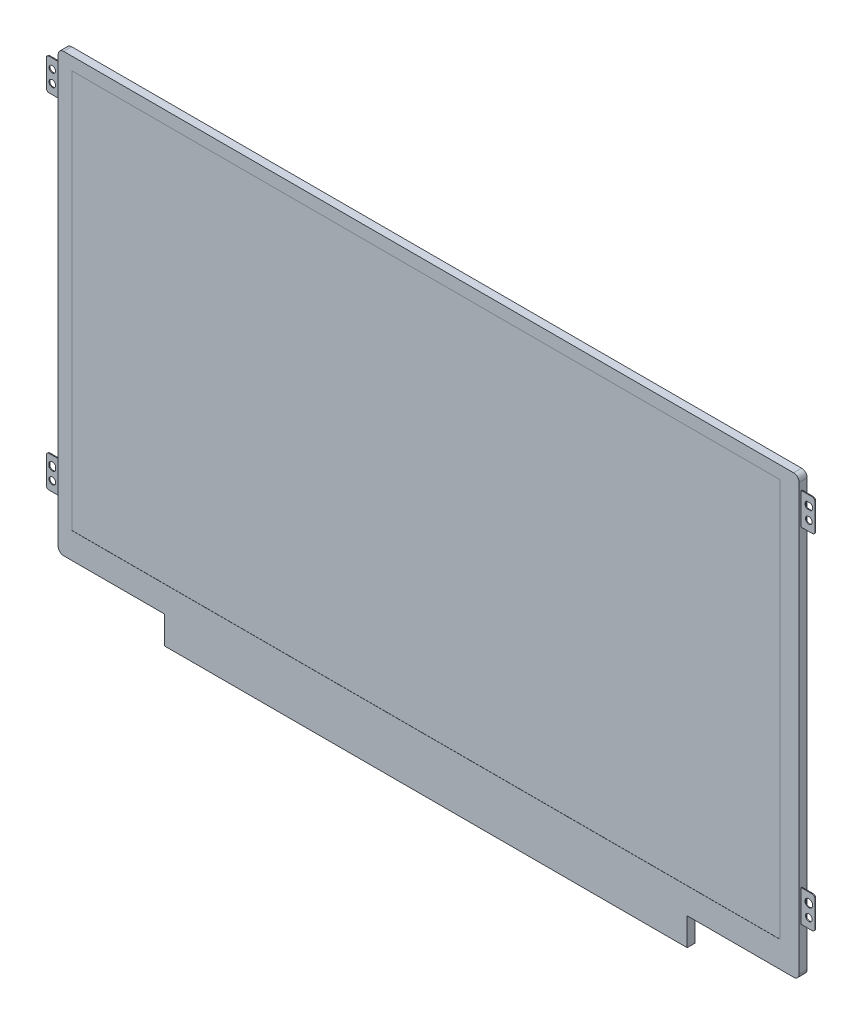
from build123d import *

# Parameters (mm, degrees)
BOSS_EXTRUDE1_DEPTH     = 2.9
SKETCH2_W               = 256.12
SKETCH2_H               = 144
CUT_EXTRUDE1_DEPTH      = 0.05
BOSS_EXTRUDE2_START     = -0.7
SKETCH3_R               = 1.2
SKETCH3_R_2             = 1.15
SKETCH3_R_3             = 1.4
BOSS_EXTRUDE2_DEPTH     = 0.3
FILLET1_R               = 2
SKETCH4_W               = 24
SKETCH4_H               = 9.2
CUT_EXTRUDE2_DEPTH      = 1.45
BOSS_EXTRUDE3_START     = -47.2
BOSS_EXTRUDE3_OUTLINE_W = 4
BOSS_EXTRUDE3_OUTLINE_H = 1
BOSS_EXTRUDE3_DEPTH     = 20.4
SKETCH6_W               = 0.2
SKETCH6_H               = 1.5
BOSS_EXTRUDE4_DEPTH     = 0.3


# Read off the part's stored shape, not the designer's step: Boss-Extrude3
with BuildPart() as part:
    # Sketch1 → Boss-Extrude1 (new body)
    with BuildSketch(Plane.XY):
        Polygon((134, 79), (-134, 79), (-134, -79), (-95.5, -79), (-95.5, -89), (93.5, -89), (93.5, -79), (134, -79), align=None)
    extrude(amount=BOSS_EXTRUDE1_DEPTH)

    # Sketch2 → Cut-Extrude1 (cut)
    with BuildSketch(Plane.XY.offset(2.9)):
        with Locations((-1, 2.4)):
            Rectangle(SKETCH2_W, SKETCH2_H)
    extrude(amount=-CUT_EXTRUDE1_DEPTH, mode=Mode.SUBTRACT)

    # Sketch3 → Boss-Extrude2 (add)
    # profile 1 of 4: a face of its own
    with BuildSketch(Plane.XY.offset(2.9).offset(BOSS_EXTRUDE2_START)):
        with BuildLine():
            Line((-134, -50.25), (-134, -61.75))
            Line((-134, -61.75), (-138, -61.75))
            ThreePointArc((-138, -61.75), (-138.707106781, -61.457106781), (-139, -60.75))
            Line((-139, -60.75), (-139, -51.25))
            ThreePointArc((-139, -51.25), (-138.707106781, -50.542893219), (-138, -50.25))
            Line((-138, -50.25), (-134, -50.25))
        make_face()
        with Locations((-136.8, -58.25)):
            Circle(SKETCH3_R, mode=Mode.SUBTRACT)
        with BuildLine():
            Line((-137.948912529, -52.95), (-137.948912529, -54.55))
            ThreePointArc((-137.948912529, -54.55), (-136.8, -55.15), (-135.651087471, -54.55))
            Line((-135.651087471, -54.55), (-135.651087471, -52.95))
            ThreePointArc((-135.651087471, -52.95), (-136.8, -52.35), (-137.948912529, -52.95))
        make_face(mode=Mode.SUBTRACT)
    # profile 2 of 4: a face of its own
    with BuildSketch(Plane.XY.offset(2.9).offset(BOSS_EXTRUDE2_START)):
        with BuildLine():
            Line((-134, 74.15), (-134, 62.65))
            Line((-134, 62.65), (-138, 62.65))
            ThreePointArc((-138, 62.65), (-138.707106781, 62.942893219), (-139, 63.65))
            Line((-139, 63.65), (-139, 73.15))
            ThreePointArc((-139, 73.15), (-138.707106781, 73.857106781), (-138, 74.15))
            Line((-138, 74.15), (-134, 74.15))
        make_face()
        with Locations((-136.8, 70.65)):
            Circle(SKETCH3_R_2, mode=Mode.SUBTRACT)
        with Locations((-136.8, 66.15)):
            Circle(SKETCH3_R, mode=Mode.SUBTRACT)
    # profile 3 of 4: a face of its own
    with BuildSketch(Plane.XY.offset(2.9).offset(BOSS_EXTRUDE2_START)):
        with BuildLine():
            Line((134, 62.65), (134, 74.15))
            Line((134, 74.15), (138, 74.15))
            ThreePointArc((138, 74.15), (138.707106781, 73.857106781), (139, 73.15))
            Line((139, 73.15), (139, 63.65))
            ThreePointArc((139, 63.65), (138.707106781, 62.942893219), (138, 62.65))
            Line((138, 62.65), (134, 62.65))
        make_face()
        with Locations((136.8, 66.15)):
            Circle(SKETCH3_R, mode=Mode.SUBTRACT)
        with BuildLine():
            Line((137.6, 69.501087471), (136, 69.501087471))
            ThreePointArc((136, 69.501087471), (135.4, 70.65), (136, 71.798912529))
            Line((136, 71.798912529), (137.6, 71.798912529))
            ThreePointArc((137.6, 71.798912529), (138.2, 70.65), (137.6, 69.501087471))
        make_face(mode=Mode.SUBTRACT)
    # profile 4 of 4: a face of its own
    with BuildSketch(Plane.XY.offset(2.9).offset(BOSS_EXTRUDE2_START)):
        with BuildLine():
            Line((134, -61.75), (134, -50.25))
            Line((134, -50.25), (138, -50.25))
            ThreePointArc((138, -50.25), (138.707106781, -50.542893219), (139, -51.25))
            Line((139, -51.25), (139, -60.75))
            ThreePointArc((139, -60.75), (138.707106781, -61.457106781), (138, -61.75))
            Line((138, -61.75), (134, -61.75))
        make_face()
        with Locations((136.8, -58.25)):
            Circle(SKETCH3_R, mode=Mode.SUBTRACT)
        with Locations((136.8, -53.75)):
            Circle(SKETCH3_R_3, mode=Mode.SUBTRACT)
    extrude(amount=-BOSS_EXTRUDE2_DEPTH)

    # Fillet1
    fillet1_edges = [part.edges().sort_by_distance(p)[0] for p in [
        (134, -79, 1.45),
        (-134, -79, 1.45),
        (-134, 79, 1.45),
        (134, 79, 1.45),
    ]]
    fillet(fillet1_edges, radius=FILLET1_R)

    # Sketch4 → Cut-Extrude2 (cut)
    with BuildSketch(Plane(origin=(0, 0, 0), x_dir=(-1, 0, 0), z_dir=(0, 0, -1))):
        with Locations((37, -84.4)):
            Rectangle(SKETCH4_W, SKETCH4_H)
    extrude(amount=-CUT_EXTRUDE2_DEPTH, mode=Mode.SUBTRACT)

    # Boss-Extrude3 outline → Boss-Extrude3 (add)
    with BuildSketch(Plane.YZ.offset(BOSS_EXTRUDE3_START)):
        with Locations((-84, 0.95)):
            Rectangle(BOSS_EXTRUDE3_OUTLINE_W, BOSS_EXTRUDE3_OUTLINE_H)
    extrude(amount=BOSS_EXTRUDE3_DEPTH)

    # Sketch6 → Boss-Extrude4 (add)
    with BuildSketch(Plane(origin=(0, 0, 1.45), x_dir=(-1, 0, 0), z_dir=(0, 0, -1))):
        with Locations((44.25, -81.25)):
            Rectangle(SKETCH6_W, SKETCH6_H)
        with Locations((43.75, -81.25)):
            Rectangle(SKETCH6_W, SKETCH6_H)
        with Locations((43.25, -81.25)):
            Rectangle(SKETCH6_W, SKETCH6_H)
        with Locations((42.75, -81.25)):
            Rectangle(SKETCH6_W, SKETCH6_H)
        with Locations((42.25, -81.25)):
            Rectangle(SKETCH6_W, SKETCH6_H)
        with Locations((41.75, -81.25)):
            Rectangle(SKETCH6_W, SKETCH6_H)
        with Locations((41.25, -81.25)):
            Rectangle(SKETCH6_W, SKETCH6_H)
        with Locations((40.75, -81.25)):
            Rectangle(SKETCH6_W, SKETCH6_H)
        with Locations((40.25, -81.25)):
            Rectangle(SKETCH6_W, SKETCH6_H)
        with Locations((39.75, -81.25)):
            Rectangle(SKETCH6_W, SKETCH6_H)
        with Locations((39.25, -81.25)):
            Rectangle(SKETCH6_W, SKETCH6_H)
        with Locations((38.75, -81.25)):
            Rectangle(SKETCH6_W, SKETCH6_H)
        with Locations((38.25, -81.25)):
            Rectangle(SKETCH6_W, SKETCH6_H)
        with Locations((37.75, -81.25)):
            Rectangle(SKETCH6_W, SKETCH6_H)
        with Locations((37.25, -81.25)):
            Rectangle(SKETCH6_W, SKETCH6_H)
        with Locations((36.75, -81.25)):
            Rectangle(SKETCH6_W, SKETCH6_H)
        with Locations((36.25, -81.25)):
            Rectangle(SKETCH6_W, SKETCH6_H)
        with Locations((35.75, -81.25)):
            Rectangle(SKETCH6_W, SKETCH6_H)
        with Locations((35.25, -81.25)):
            Rectangle(SKETCH6_W, SKETCH6_H)
        with Locations((34.75, -81.25)):
            Rectangle(SKETCH6_W, SKETCH6_H)
        with Locations((34.25, -81.25)):
            Rectangle(SKETCH6_W, SKETCH6_H)
        with Locations((33.75, -81.25)):
            Rectangle(SKETCH6_W, SKETCH6_H)
        with Locations((33.25, -81.25)):
            Rectangle(SKETCH6_W, SKETCH6_H)
        with Locations((32.75, -81.25)):
            Rectangle(SKETCH6_W, SKETCH6_H)
        with Locations((32.25, -81.25)):
            Rectangle(SKETCH6_W, SKETCH6_H)
        with Locations((31.75, -81.25)):
            Rectangle(SKETCH6_W, SKETCH6_H)
        with Locations((31.25, -81.25)):
            Rectangle(SKETCH6_W, SKETCH6_H)
        with Locations((30.75, -81.25)):
            Rectangle(SKETCH6_W, SKETCH6_H)
        with Locations((30.25, -81.25)):
            Rectangle(SKETCH6_W, SKETCH6_H)
        with Locations((29.75, -81.25)):
            Rectangle(SKETCH6_W, SKETCH6_H)
    extrude(amount=BOSS_EXTRUDE4_DEPTH)


solid = part.part
